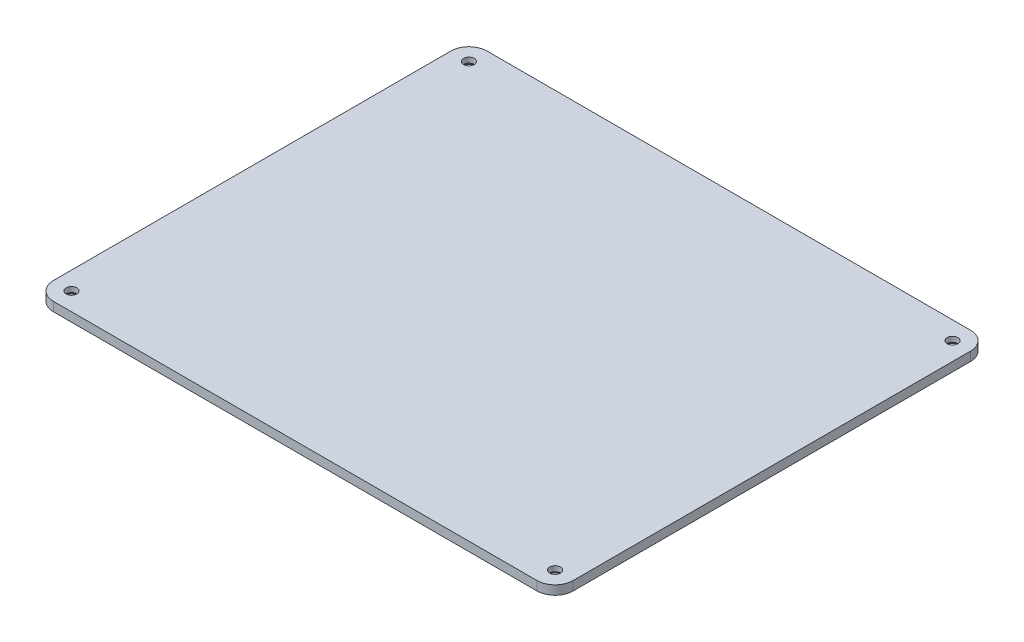
from build123d import *

# Parameters (mm, degrees)
SKETCH1_W                      = 86.201
SKETCH1_H                      = 71.913
BOSS_EXTRUDE1_DEPTH            = 1.5
FILLET1_R                      = 3
F_2_56_TAPPED_HOLE1_AT_2_COUNT = 2
F_2_56_TAPPED_HOLE1_AT_2_PITCH = 80.201
F_2_56_TAPPED_HOLE1_AT_3_COUNT = 2
F_2_56_TAPPED_HOLE1_AT_3_PITCH = 103.811001199
F_2_56_TAPPED_HOLE1_AT_4_COUNT = 2
F_2_56_TAPPED_HOLE1_AT_4_PITCH = 65.913


with BuildPart() as part:
    # Sketch1 → Boss-Extrude1 (new body)
    with BuildSketch(Plane(origin=(0, 0, 0), x_dir=(1, 0, 0), z_dir=(0, 1, 0))):
        Rectangle(SKETCH1_W, SKETCH1_H)
    extrude(amount=BOSS_EXTRUDE1_DEPTH)

    # Fillet1
    fillet1_edges = [part.edges().sort_by_distance(p)[0] for p in [
        (-43.1005, 0.75, 35.9565),
        (-43.1005, 0.75, -35.9565),
        (43.1005, 0.75, -35.9565),
        (43.1005, 0.75, 35.9565),
    ]]
    fillet(fillet1_edges, radius=FILLET1_R)

    # Sketch4 → #2-56 Tapped Hole1 (revolve, cut)
    with BuildSketch(Plane(origin=(-40.1005, 0, 32.9565), x_dir=(0, 0, -1), z_dir=(1, 0, 0))):
        Polygon((0, 0), (0, 1.5), (0.889, 1.5), (0.889, 0.635), (1.524, 0), align=None)
    f_2_56_tapped_hole1 = revolve(axis=Axis((-40.1005, -6.35, 32.9565), (0, 1, 0)), mode=Mode.SUBTRACT)

    # #2-56 Tapped Hole1 at 2: #2-56 Tapped Hole1 ×2
    with Locations(*[(i * F_2_56_TAPPED_HOLE1_AT_2_PITCH, 0, 0) for i in range(1, F_2_56_TAPPED_HOLE1_AT_2_COUNT)]):
        add(f_2_56_tapped_hole1, mode=Mode.SUBTRACT)

    # #2-56 Tapped Hole1 at 3: #2-56 Tapped Hole1 ×2
    with Locations(*[Vector(0.7725674453907951, 0, -0.634932706924396) * (i * F_2_56_TAPPED_HOLE1_AT_3_PITCH) for i in range(1, F_2_56_TAPPED_HOLE1_AT_3_COUNT)]):
        add(f_2_56_tapped_hole1, mode=Mode.SUBTRACT)

    # #2-56 Tapped Hole1 at 4: #2-56 Tapped Hole1 ×2
    with Locations(*[(0, 0, -i * F_2_56_TAPPED_HOLE1_AT_4_PITCH) for i in range(1, F_2_56_TAPPED_HOLE1_AT_4_COUNT)]):
        add(f_2_56_tapped_hole1, mode=Mode.SUBTRACT)


solid = part.part
